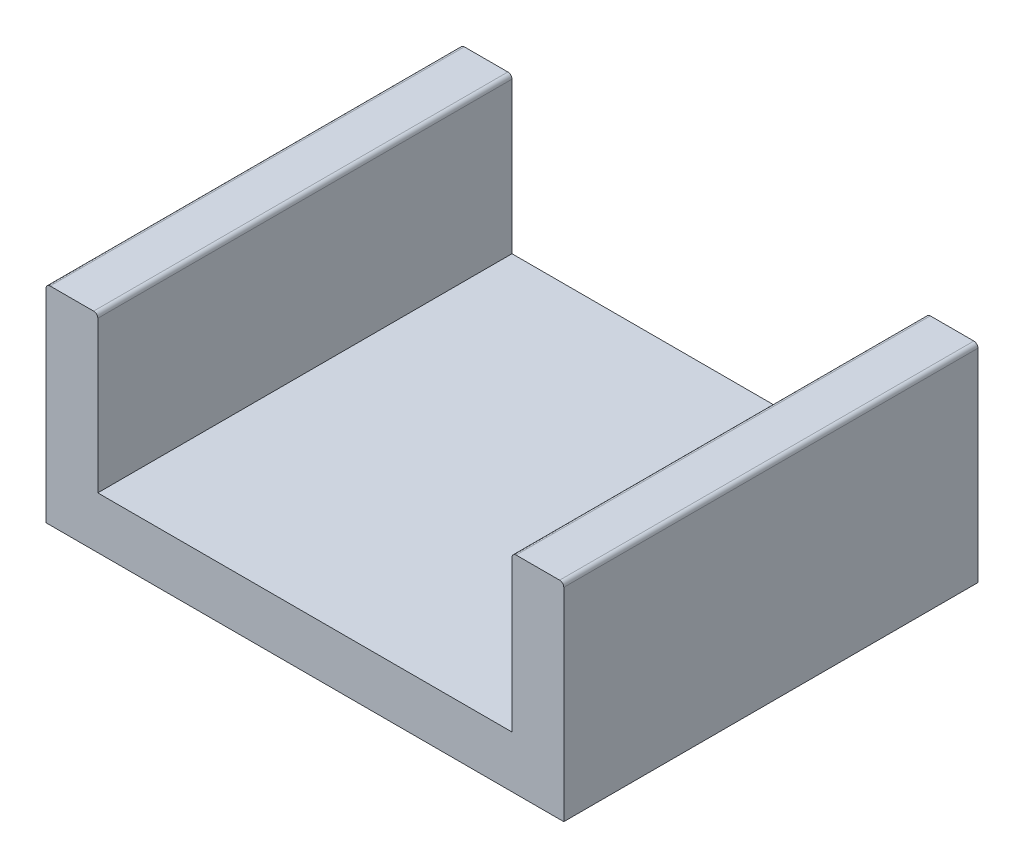
from build123d import *

# Parameters (mm, degrees)
BOSS_EXTRUDE1_DEPTH = 25.4
FILLET1_R           = 0.254


with BuildPart() as part:
    # Sketch1 → Boss-Extrude1 (new body)
    with BuildSketch(Plane.XY):
        Polygon((0, 0), (0, 12.7), (3.175, 12.7), (3.175, 3.175), (28.575, 3.175), (28.575, 12.7), (31.75, 12.7), (31.75, 0), align=None)
    extrude(amount=BOSS_EXTRUDE1_DEPTH)

    # Fillet1
    fillet1_edges = [part.edges().sort_by_distance(p)[0] for p in [
        (31.75, 12.7, 12.7),
        (28.575, 12.7, 12.7),
        (0, 12.7, 12.7),
        (3.175, 12.7, 12.7),
    ]]
    fillet(fillet1_edges, radius=FILLET1_R)


solid = part.part
